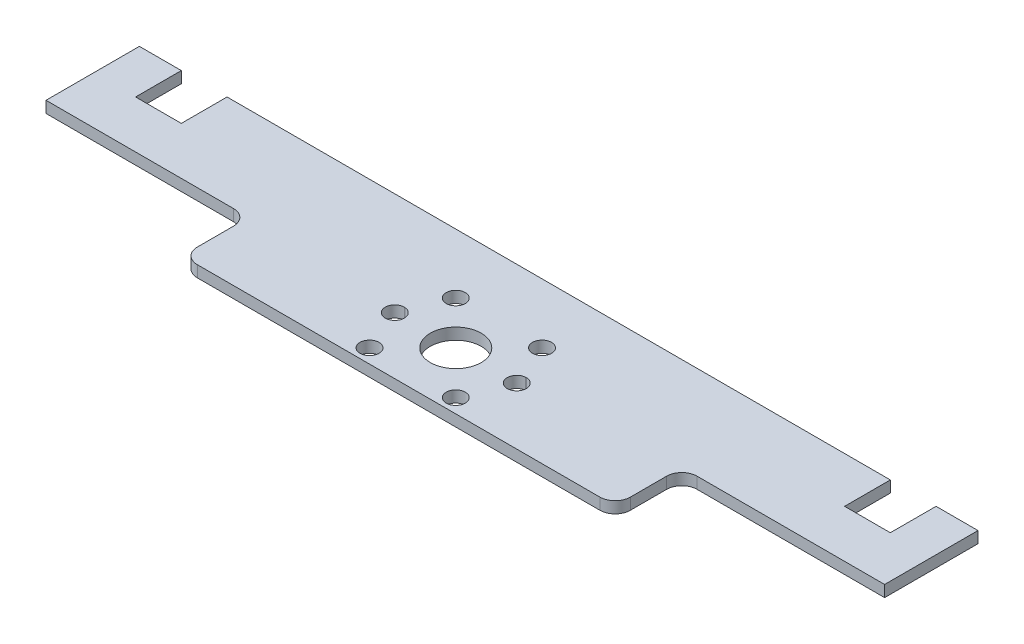
from build123d import *

# Parameters (mm, degrees)
SKETCH_2_R      = 2.5
SKETCH_2_R_2    = 6.682030953
EXTRUDE_1_DEPTH = 3
FILLET_1_R      = 4


with BuildPart() as part:
    # 草图2 → 凸台-拉伸1 (new body)
    with BuildSketch(Plane(origin=(0, 0, 0), x_dir=(1, 0, 0), z_dir=(0, 1, 0))):
        Polygon((56.805521657, -9.248304321), (110, -9.248304321), (110, 15.251695679), (99, 15.251695679), (99, 3.251695679), (87, 3.251695679), (87, 15.251695679), (-87, 15.251695679), (-87, 3.251695679), (-99, 3.251695679), (-99, 15.251695679), (-110, 15.251695679), (-110, -9.248304321), (-56.805521657, -9.248304321), (-56.805521657, -26.748304321), (56.805521657, -26.748304321), align=None)
        with BuildLine():
            Line((15.803480629, -9.248304321), (16, -9.248304321))
            ThreePointArc((16, -9.248304321), (16.097730955, -14.246393323), (15.8046875, -9.255945393))
            ThreePointArc((15.8046875, -9.255945393), (15.804084526, -9.252124784), (15.803480629, -9.248304321))
        make_face(mode=Mode.SUBTRACT)
        with Locations((11.313708499, -0.434595822)):
            Circle(SKETCH_2_R, mode=Mode.SUBTRACT)
        with Locations((11.313708499, -23.06201282)):
            Circle(SKETCH_2_R, mode=Mode.SUBTRACT)
        with Locations((0, -11.748304321)):
            Circle(SKETCH_2_R_2, mode=Mode.SUBTRACT)
        with Locations((-11.3137085, -0.434595822)):
            Circle(SKETCH_2_R, mode=Mode.SUBTRACT)
        with BuildLine():
            Line((-15.999999937, -9.248304321), (-15.803480629, -9.248304321))
            ThreePointArc((-15.803480629, -9.248304321), (-15.804084526, -9.252124784), (-15.8046875, -9.255945394))
            ThreePointArc((-15.8046875, -9.255945394), (-16.097730988, -14.246393322), (-15.999999937, -9.248304322))
        make_face(mode=Mode.SUBTRACT)
        with Locations((-11.313708499, -23.062012821)):
            Circle(SKETCH_2_R, mode=Mode.SUBTRACT)
    extrude(amount=EXTRUDE_1_DEPTH)

    # 圆角1
    fillet_1_edges = [part.edges().sort_by_distance(p)[0] for p in [
        (56.805521657, 1.5, 9.248304321),
        (56.805521657, 1.5, 26.748304321),
        (-56.805521657, 1.5, 9.248304321),
        (-56.805521657, 1.5, 26.748304321),
    ]]
    fillet(fillet_1_edges, radius=FILLET_1_R)


solid = part.part
